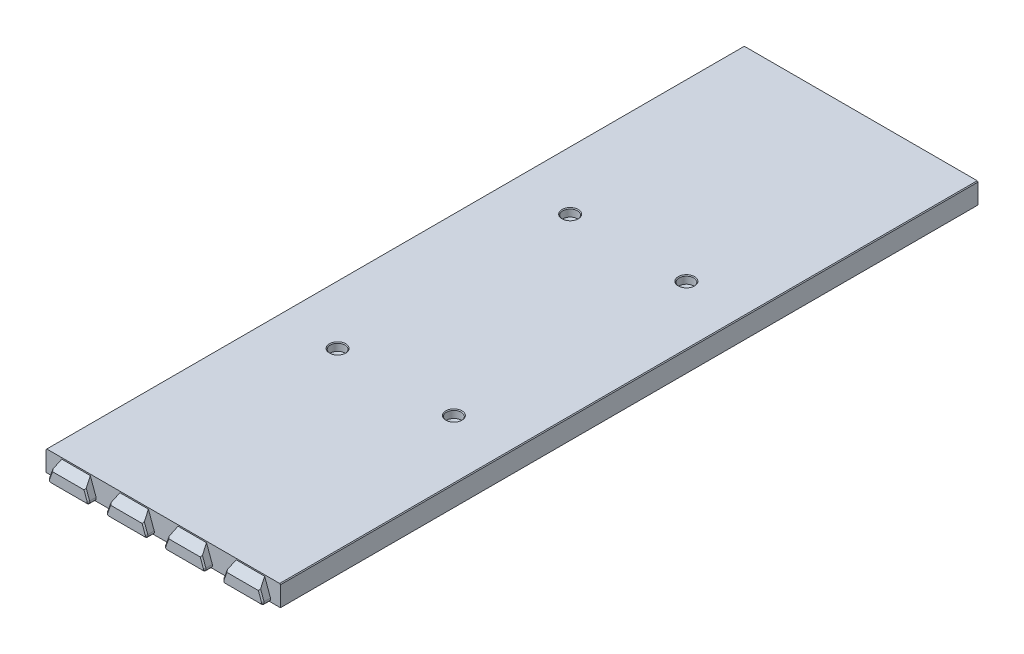
from build123d import *

# Parameters (mm, degrees)
BOSS_EXTRUDE1_DEPTH             = 135
SKETCH7_W                       = 86.75
SKETCH7_H                       = 6
BOSS_EXTRUDE7_DEPTH             = 1
BOSS_EXTRUDE4_DEPTH             = 3
BOSS_EXTRUDE8_REACH             = 144.646
BOSS_EXTRUDE8_DIRECTION_2_DEPTH = 2
CHAMFER4_SIZE                   = 0.5
FILLET4_R                       = 1
CHAMFER6_SIZE                   = 0.5
FILLET2_R                       = 2
CHAMFER4_OF_MIRROR2_SIZE        = 0.5
FILLET4_OF_MIRROR2_R            = 1
CHAMFER6_OF_MIRROR2_SIZE        = 0.5
FILLET2_OF_MIRROR2_R            = 2
BOSS_EXTRUDE9_REACH             = 278.861
SKETCH9_R                       = 5
FILLET3_R                       = 3
SKETCH10_R                      = 1.85
CUT_EXTRUDE2_DEPTH              = 277.860778416
SKETCH11_R                      = 2.85
CUT_EXTRUDE3_DEPTH              = 3
CHAMFER7_SIZE                   = 1
CUT_EXTRUDE4_DEPTH              = 277.860778416
CUT_EXTRUDE4_DEPTH_BACK         = 277.860778416
CHAMFER8_SIZE                   = 0.3


with BuildPart() as part:
    # Sketch1 → Boss-Extrude1 (new body)
    with BuildSketch(Plane.XY):
        Polygon((-45.375, 0), (-45.375, 8), (45.375, 8), (45.375, 0), (43.375, 0), (43.375, 6), (-43.375, 6), (-43.375, 0), align=None)
    boss_extrude1 = extrude(amount=-BOSS_EXTRUDE1_DEPTH)

    # Sketch7 → Boss-Extrude7 (add)
    with BuildSketch(Plane.XY):
        with Locations((0, 3)):
            Rectangle(SKETCH7_W, SKETCH7_H)
    boss_extrude7 = extrude(amount=-BOSS_EXTRUDE7_DEPTH)

    # Sketch2 → Boss-Extrude4 (add)
    with BuildSketch(Plane.XY):
        Polygon((28.411761874, 8), (25.5, 0), (42, 0), (39.088238126, 8), align=None)
        Polygon((5.911761874, 8), (3, 0), (19.5, 0), (16.588238126, 8), align=None)
        Polygon((-16.588238126, 8), (-19.5, 0), (-3, 0), (-5.911761874, 8), align=None)
        Polygon((-39.088238126, 8), (-42, 0), (-25.5, 0), (-28.411761874, 8), align=None)
    boss_extrude4 = extrude(amount=BOSS_EXTRUDE4_DEPTH)

    # Sketch8 → Boss-Extrude8 (add, up to next)
    with BuildSketch(Plane.XZ, mode=Mode.PRIVATE) as boss_extrude8_sk1:
        Polygon((-43.85, -20.258341264), (-40.15, -21.605031131), (-40.15, -23.394968869), (-43.85, -24.741658736), align=None)
    boss_extrude8_tool1 = extrude(boss_extrude8_sk1.sketch, amount=-BOSS_EXTRUDE8_REACH, mode=Mode.PRIVATE) - part.part
    # Sketch8 → Boss-Extrude8 (add, up to next)
    with BuildSketch(Plane.XZ, mode=Mode.PRIVATE) as boss_extrude8_sk2:
        Polygon((-43.85, -132.758341264), (-40.15, -134.105031131), (-40.15, -134.85), (-40.15, -135), (-43.85, -135), (-43.85, -134.85), align=None)
    boss_extrude8_tool2 = extrude(boss_extrude8_sk2.sketch, amount=-BOSS_EXTRUDE8_REACH, mode=Mode.PRIVATE) - part.part
    # Sketch8 → Boss-Extrude8 (add, up to next)
    with BuildSketch(Plane.XZ, mode=Mode.PRIVATE) as boss_extrude8_sk3:
        Polygon((43.85, -135), (40.15, -135), (40.15, -134.85), (40.15, -134.105031131), (43.85, -132.758341264), (43.85, -134.85), align=None)
    boss_extrude8_tool3 = extrude(boss_extrude8_sk3.sketch, amount=-BOSS_EXTRUDE8_REACH, mode=Mode.PRIVATE) - part.part
    # Sketch8 → Boss-Extrude8 (add, up to next)
    with BuildSketch(Plane.XZ, mode=Mode.PRIVATE) as boss_extrude8_sk4:
        Polygon((43.85, -24.741658736), (43.85, -20.258341264), (40.15, -21.605031131), (40.15, -23.394968869), align=None)
    boss_extrude8_tool4 = extrude(boss_extrude8_sk4.sketch, amount=-BOSS_EXTRUDE8_REACH, mode=Mode.PRIVATE) - part.part
    boss_extrude8_1 = boss_extrude8_tool1.solids().sort_by_distance((-42.264762, 0, -22.5))[0]
    add(boss_extrude8_1)
    boss_extrude8_2 = boss_extrude8_tool2.solids().sort_by_distance((-42.264762, 0, -134.16766))[0]
    add(boss_extrude8_2)
    boss_extrude8_3 = boss_extrude8_tool3.solids().sort_by_distance((42.264762, 0, -134.16766))[0]
    add(boss_extrude8_3)
    boss_extrude8_4 = boss_extrude8_tool4.solids().sort_by_distance((42.264762, 0, -22.5))[0]
    add(boss_extrude8_4)
    boss_extrude8 = boss_extrude8_1 + boss_extrude8_2 + boss_extrude8_3 + boss_extrude8_4  # Boss-Extrude8 as one shape, for the pattern or mirror that repeats it

    # Sketch8 → Boss-Extrude8 direction 2 (add)
    with BuildSketch(Plane.XZ):
        Polygon((-43.85, -20.258341264), (-40.15, -21.605031131), (-40.15, -23.394968869), (-43.85, -24.741658736), align=None)
        Polygon((-43.85, -132.758341264), (-40.15, -134.105031131), (-40.15, -134.85), (-40.15, -135), (-43.85, -135), (-43.85, -134.85), align=None)
        Polygon((43.85, -135), (40.15, -135), (40.15, -134.85), (40.15, -134.105031131), (43.85, -132.758341264), (43.85, -134.85), align=None)
        Polygon((43.85, -24.741658736), (43.85, -20.258341264), (40.15, -21.605031131), (40.15, -23.394968869), align=None)
    boss_extrude8_direction_2 = extrude(amount=BOSS_EXTRUDE8_DIRECTION_2_DEPTH)

    # Chamfer4
    chamfer4_edges = [part.edges().sort_by_distance(p)[0] for p in [
        (-43.85, -2, -22.5),
        (-42, -2, -24.068313803),
        (-40.15, -2, -22.5),
        (-42, -2, -20.931686197),
        (-43.85, -2, -133.879170632),
        (-40.15, -2, -134.552515565),
        (-42, -2, -133.431686197),
        (43.85, -2, -133.879170632),
        (42, -2, -133.431686197),
        (40.15, -2, -134.552515565),
        (42, -2, -24.068313803),
        (43.85, -2, -22.5),
        (42, -2, -20.931686197),
        (40.15, -2, -22.5),
    ]]
    chamfer(chamfer4_edges, length=CHAMFER4_SIZE)

    # Fillet4
    fillet4_edges = [part.edges().sort_by_distance(p)[0] for p in [
        (25.5, 0, 1.5),
        (42, 0, 1.5),
        (3, 0, 1.5),
        (19.5, 0, 1.5),
        (-19.5, 0, 1.5),
        (-3, 0, 1.5),
        (-42, 0, 1.5),
        (-25.5, 0, 1.5),
    ]]
    fillet(fillet4_edges, radius=FILLET4_R)

    # Chamfer6
    chamfer6_edges = [part.edges().sort_by_distance(p)[0] for p in [
        (40.29989137, 4.671010072, 3),
        (33.75, 0, 3),
        (11.25, 0, 3),
        (-11.25, 0, 3),
        (-33.75, 0, 3),
        (26.108995962, 0.426423564, 3),
        (41.391004038, 0.426423564, 3),
        (17.79989137, 4.671010072, 3),
        (3.608995962, 0.426423564, 3),
        (18.891004038, 0.426423564, 3),
        (-4.70010863, 4.671010072, 3),
        (-18.891004038, 0.426423564, 3),
        (-3.608995962, 0.426423564, 3),
        (-27.20010863, 4.671010072, 3),
        (-41.391004038, 0.426423564, 3),
        (-26.108995962, 0.426423564, 3),
        (27.20010863, 4.671010072, 3),
        (4.70010863, 4.671010072, 3),
        (-17.79989137, 4.671010072, 3),
        (-40.29989137, 4.671010072, 3),
    ]]
    chamfer(chamfer6_edges, length=CHAMFER6_SIZE)

    # Fillet2
    fillet2_edges = [part.edges().sort_by_distance(p)[0] for p in [
        (-43.375, 6, -10.715613563),
        (-43.375, 3, -24.568772875),
        (-43.375, 3, -20.431227125),
        (-41.7625, 6, -23.981870872),
        (-41.7625, 6, -21.018129128),
        (-40.15, 6, -22.5),
        (-43.375, 6, -78.75),
        (-43.375, 3, -132.931227125),
        (-40.15, 6, -134.552515565),
        (-41.7625, 6, -133.518129128),
        (43.375, 6, -78.75),
        (43.375, 3, -132.931227125),
        (41.7625, 6, -133.518129128),
        (40.15, 6, -134.552515565),
        (43.375, 6, -10.715613563),
        (43.375, 3, -24.568772875),
        (43.375, 3, -20.431227125),
        (41.7625, 6, -23.981870872),
        (40.15, 6, -22.5),
        (41.7625, 6, -21.018129128),
        (-43.375, 3, -1),
        (0, 6, -1),
        (43.375, 3, -1),
    ]]
    fillet(fillet2_edges, radius=FILLET2_R)


with BuildPart() as mirror2_1:
    # Mirror2: Boss-Extrude1, Boss-Extrude7, Boss-Extrude4, Boss-Extrude8, Boss-Extrude8 direction 2 across plane
    add(boss_extrude1.mirror(Plane.XY.offset(-135)))
    add(boss_extrude7.mirror(Plane.XY.offset(-135)))
    add(boss_extrude4.mirror(Plane.XY.offset(-135)))
    add(boss_extrude8.mirror(Plane.XY.offset(-135)))
    add(boss_extrude8_direction_2.mirror(Plane.XY.offset(-135)))

    # Chamfer4 of Mirror2
    chamfer4_of_mirror2_edges = [mirror2_1.edges().sort_by_distance(p)[0] for p in [
        (-43.85, -2, -247.5),
        (-42, -2, -245.931686197),
        (-40.15, -2, -247.5),
        (-42, -2, -249.068313803),
        (-43.85, -2, -136.120829368),
        (-40.15, -2, -135.447484435),
        (-42, -2, -136.568313803),
        (43.85, -2, -136.120829368),
        (42, -2, -136.568313803),
        (40.15, -2, -135.447484435),
        (42, -2, -245.931686197),
        (43.85, -2, -247.5),
        (42, -2, -249.068313803),
        (40.15, -2, -247.5),
    ]]
    chamfer(chamfer4_of_mirror2_edges, length=CHAMFER4_OF_MIRROR2_SIZE)

    # Fillet4 of Mirror2
    fillet4_of_mirror2_edges = [mirror2_1.edges().sort_by_distance(p)[0] for p in [
        (25.5, 0, -271.5),
        (42, 0, -271.5),
        (3, 0, -271.5),
        (19.5, 0, -271.5),
        (-19.5, 0, -271.5),
        (-3, 0, -271.5),
        (-42, 0, -271.5),
        (-25.5, 0, -271.5),
    ]]
    fillet(fillet4_of_mirror2_edges, radius=FILLET4_OF_MIRROR2_R)

    # Chamfer6 of Mirror2
    chamfer6_of_mirror2_edges = [mirror2_1.edges().sort_by_distance(p)[0] for p in [
        (40.29989137, 4.671010072, -273),
        (33.75, 0, -273),
        (11.25, 0, -273),
        (-11.25, 0, -273),
        (-33.75, 0, -273),
        (26.108995962, 0.426423564, -273),
        (41.391004038, 0.426423564, -273),
        (17.79989137, 4.671010072, -273),
        (3.608995962, 0.426423564, -273),
        (18.891004038, 0.426423564, -273),
        (-4.70010863, 4.671010072, -273),
        (-18.891004038, 0.426423564, -273),
        (-3.608995962, 0.426423564, -273),
        (-27.20010863, 4.671010072, -273),
        (-41.391004038, 0.426423564, -273),
        (-26.108995962, 0.426423564, -273),
        (27.20010863, 4.671010072, -273),
        (4.70010863, 4.671010072, -273),
        (-17.79989137, 4.671010072, -273),
        (-40.29989137, 4.671010072, -273),
    ]]
    chamfer(chamfer6_of_mirror2_edges, length=CHAMFER6_OF_MIRROR2_SIZE)

    # Fillet2 of Mirror2
    fillet2_of_mirror2_edges = [mirror2_1.edges().sort_by_distance(p)[0] for p in [
        (-43.375, 6, -259.284386437),
        (-43.375, 3, -245.431227125),
        (-43.375, 3, -249.568772875),
        (-41.7625, 6, -246.018129128),
        (-41.7625, 6, -248.981870872),
        (-40.15, 6, -247.5),
        (-43.375, 6, -191.25),
        (-43.375, 3, -137.068772875),
        (-40.15, 6, -135.447484435),
        (-41.7625, 6, -136.481870872),
        (43.375, 6, -191.25),
        (43.375, 3, -137.068772875),
        (41.7625, 6, -136.481870872),
        (40.15, 6, -135.447484435),
        (43.375, 6, -259.284386437),
        (43.375, 3, -245.431227125),
        (43.375, 3, -249.568772875),
        (41.7625, 6, -246.018129128),
        (40.15, 6, -247.5),
        (41.7625, 6, -248.981870872),
        (-43.375, 3, -269),
        (0, 6, -269),
        (43.375, 3, -269),
    ]]
    fillet(fillet2_of_mirror2_edges, radius=FILLET2_OF_MIRROR2_R)


with BuildPart() as part_1:
    add(part.part)

    # Mirror2 united with what the copies touc: union Mirror2_1
    add(mirror2_1.part)

    # Sketch9 → Boss-Extrude9 (add, up to next)
    with BuildSketch(Plane(origin=(0, 0, 0), x_dir=(1, 0, 0), z_dir=(0, 1, 0)), mode=Mode.PRIVATE) as boss_extrude9_sk1:
        with Locations(Location((-22.5, 90, 0), (0, 0, 90))):
            Circle(SKETCH9_R)
    boss_extrude9_tool1 = extrude(boss_extrude9_sk1.sketch, amount=BOSS_EXTRUDE9_REACH, mode=Mode.PRIVATE) - part_1.part
    # Sketch9 → Boss-Extrude9 (add, up to next)
    with BuildSketch(Plane(origin=(0, 0, 0), x_dir=(1, 0, 0), z_dir=(0, 1, 0)), mode=Mode.PRIVATE) as boss_extrude9_sk2:
        with Locations(Location((22.5, 90, 0), (0, 0, 90))):
            Circle(SKETCH9_R)
    boss_extrude9_tool2 = extrude(boss_extrude9_sk2.sketch, amount=BOSS_EXTRUDE9_REACH, mode=Mode.PRIVATE) - part_1.part
    # Sketch9 → Boss-Extrude9 (add, up to next)
    with BuildSketch(Plane(origin=(0, 0, 0), x_dir=(1, 0, 0), z_dir=(0, 1, 0)), mode=Mode.PRIVATE) as boss_extrude9_sk3:
        with Locations(Location((22.5, 180, 0), (0, 0, 90))):
            Circle(SKETCH9_R)
    boss_extrude9_tool3 = extrude(boss_extrude9_sk3.sketch, amount=BOSS_EXTRUDE9_REACH, mode=Mode.PRIVATE) - part_1.part
    # Sketch9 → Boss-Extrude9 (add, up to next)
    with BuildSketch(Plane(origin=(0, 0, 0), x_dir=(1, 0, 0), z_dir=(0, 1, 0)), mode=Mode.PRIVATE) as boss_extrude9_sk4:
        with Locations(Location((-22.5, 180, 0), (0, 0, 90))):
            Circle(SKETCH9_R)
    boss_extrude9_tool4 = extrude(boss_extrude9_sk4.sketch, amount=BOSS_EXTRUDE9_REACH, mode=Mode.PRIVATE) - part_1.part
    add(boss_extrude9_tool1.solids().sort_by_distance((-22.5, 0, -90))[0])
    add(boss_extrude9_tool2.solids().sort_by_distance((22.5, 0, -90))[0])
    add(boss_extrude9_tool3.solids().sort_by_distance((22.5, 0, -180))[0])
    add(boss_extrude9_tool4.solids().sort_by_distance((-22.5, 0, -180))[0])

    # Fillet3
    fillet3_edges = [part_1.edges().sort_by_distance(p)[0] for p in [
        (-22.5, 6, -85),
        (-22.5, 6, -175),
        (22.5, 6, -175),
        (22.5, 6, -85),
    ]]
    fillet(fillet3_edges, radius=FILLET3_R)

    # Sketch10 → Cut-Extrude2 (cut, through all)
    with BuildSketch(Plane(origin=(0, 0, 0), x_dir=(1, 0, 0), z_dir=(0, 1, 0))):
        with Locations(Location((-22.5, 180, 0), (0, 0, 270))):
            Circle(SKETCH10_R)
        with Locations(Location((-22.5, 90, 0), (0, 0, 270))):
            Circle(SKETCH10_R)
        with Locations(Location((22.5, 90, 0), (0, 0, 270))):
            Circle(SKETCH10_R)
        with Locations(Location((22.5, 180, 0), (0, 0, 270))):
            Circle(SKETCH10_R)
    extrude(amount=CUT_EXTRUDE2_DEPTH, mode=Mode.SUBTRACT)

    # Sketch11 → Cut-Extrude3 (cut)
    with BuildSketch(Plane(origin=(0, 8, 0), x_dir=(1, 0, 0), z_dir=(0, 1, 0))):
        with Locations(Location((-22.5, 180, 0), (0, 0, 270))):
            Circle(SKETCH11_R)
        with Locations(Location((22.5, 180, 0), (0, 0, 270))):
            Circle(SKETCH11_R)
        with Locations(Location((22.5, 90, 0), (0, 0, 270))):
            Circle(SKETCH11_R)
        with Locations(Location((-22.5, 90, 0), (0, 0, 270))):
            Circle(SKETCH11_R)
    extrude(amount=-CUT_EXTRUDE3_DEPTH, mode=Mode.SUBTRACT)

    # Chamfer7
    chamfer7_edges = [part_1.edges().sort_by_distance(p)[0] for p in [
        (-22.5, 5, -91.85),
        (22.5, 5, -91.85),
        (22.5, 5, -181.85),
        (-22.5, 5, -181.85),
    ]]
    chamfer(chamfer7_edges, length=CHAMFER7_SIZE - 0.0001)  # a hair under: the kernel refuses the full size

    # Sketch12 → Cut-Extrude4 (cut, two sides: drawn at the far end of the back side and taken through both)
    with BuildSketch(Plane(origin=(0, 0, 0), x_dir=(0, 0, -1), z_dir=(1, 0, 0)).offset(-CUT_EXTRUDE4_DEPTH_BACK)):
        Polygon((0, 7.5), (-3, 4.5), (-3, 7.5), (-3, 8), (0, 8), align=None)
        Polygon((273, 8), (273, 7.5), (273, 4.5), (270, 7.5), (270, 8), align=None)
    extrude(amount=CUT_EXTRUDE4_DEPTH + CUT_EXTRUDE4_DEPTH_BACK, mode=Mode.SUBTRACT)

    # Chamfer8
    chamfer8_edges = [part_1.edges().sort_by_distance(p)[0] for p in [
        (-45.375, 8, -135),
        (45.375, 8, -135),
        (-22.5, 8, -92.85),
        (22.5, 8, -92.85),
        (22.5, 8, -182.85),
        (-22.5, 8, -182.85),
    ]]
    chamfer(chamfer8_edges, length=CHAMFER8_SIZE)


solid = part_1.part
